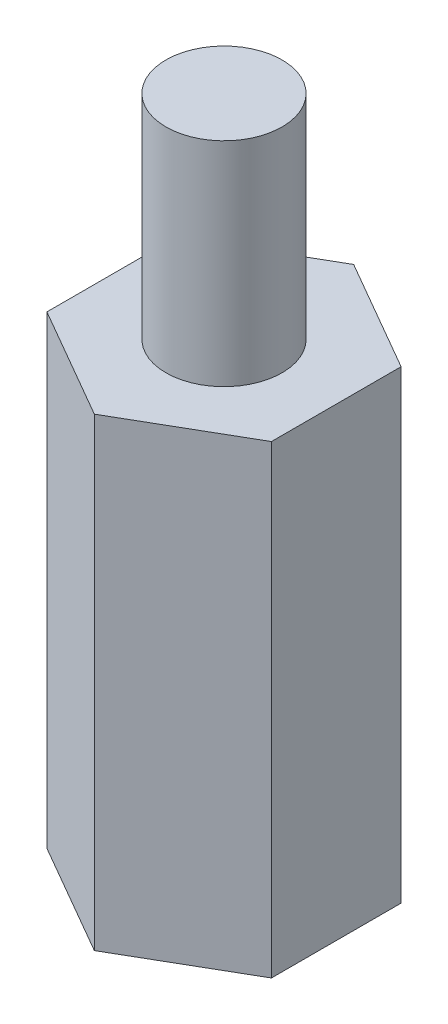
from build123d import *

# Parameters (mm, degrees)
SKETCH1_R           = 1.5
BOSS_EXTRUDE1_DEPTH = 6
SKETCH2_R           = 1.5
BOSS_EXTRUDE2_DEPTH = 5.5


with BuildPart() as part:
    # Sketch1 → Boss-Extrude1 (new, symmetric)
    with BuildSketch(Plane(origin=(0, 0, 0), x_dir=(1, 0, 0), z_dir=(0, 1, 0))):
        Polygon((0, -3.348631561), (2.9, -1.674315781), (2.9, 1.674315781), (0, 3.348631561), (-2.9, 1.674315781), (-2.9, -1.674315781), align=None)
        Circle(SKETCH1_R, mode=Mode.SUBTRACT)
    extrude(amount=BOSS_EXTRUDE1_DEPTH, both=True)


with BuildPart() as body_2:
    # Sketch2 → Boss-Extrude2 (new body)
    with BuildSketch(Plane(origin=(0, 6, 0), x_dir=(1, 0, 0), z_dir=(0, 1, 0))):
        Circle(SKETCH2_R)
    extrude(amount=BOSS_EXTRUDE2_DEPTH)


solid = Compound([part.part, body_2.part])
